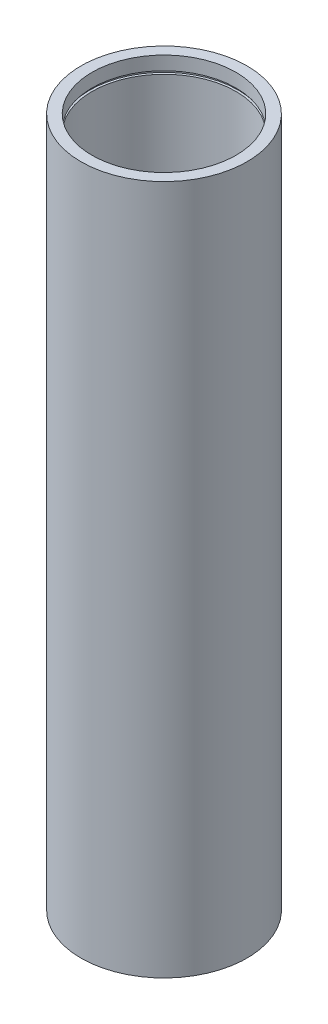
from build123d import *


with BuildPart() as part:
    # Sketch2 → Revolve1 (revolve)
    with BuildSketch(Plane.XY):
        Polygon((41.275, 385.9276), (41.275, 11.2522), (42.5958, 11.2522), (42.5958, 9.525), (41.275, 9.525), (41.275, 0), (47.625, 0), (47.625, 395.4526), (41.275, 395.4526), (41.275, 387.6548), (42.5958, 387.6548), (42.5958, 385.9276), align=None)
    revolve(axis=Axis((0, 0, 0), (0, 1, 0)))


solid = part.part
